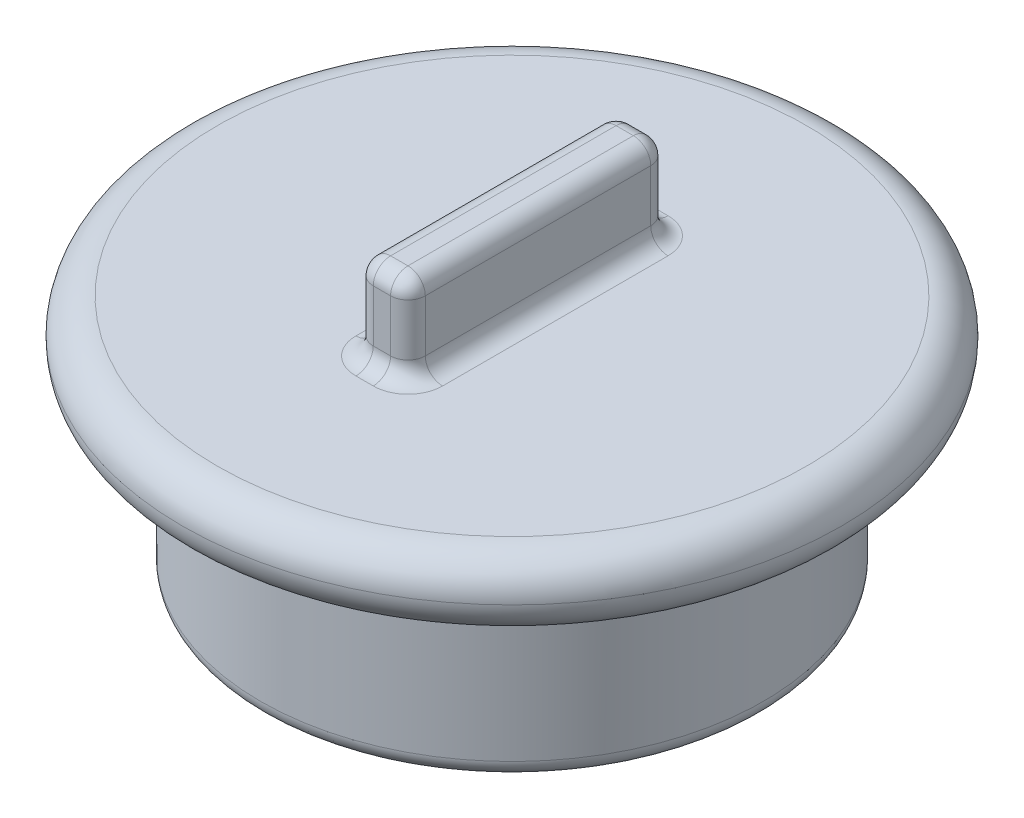
from build123d import *

# Parameters (mm, degrees)
SKETCH_1_R      = 19
EXTRUDE_1_DEPTH = 4
SKETCH_2_W      = 3
SKETCH_2_H      = 15
EXTRUDE_2_DEPTH = 5
FILLET_1_R      = 1
FILLET_3_R      = 2
SKETCH_3_R      = 14.5
SKETCH_3_R_2    = 12.5
EXTRUDE_3_DEPTH = 10
FILLET_4_R      = 1


with BuildPart() as part:
    # 草圖1 → 填料-伸長1 (new body)
    with BuildSketch(Plane(origin=(0, 0, 0), x_dir=(1, 0, 0), z_dir=(0, 1, 0))):
        with Locations(Location((0, 0, 0), (0, 0, 270))):
            Circle(SKETCH_1_R)
    extrude(amount=EXTRUDE_1_DEPTH)

    # 草圖2 → 填料-伸長2 (add)
    with BuildSketch(Plane(origin=(0, 4, 0), x_dir=(1, 0, 0), z_dir=(0, 1, 0))):
        Rectangle(SKETCH_2_W, SKETCH_2_H)
    extrude(amount=EXTRUDE_2_DEPTH)

    # 圓角1
    fillet_1_edges = [part.edges().sort_by_distance(p)[0] for p in [
        (-1.5, 4, 0),
        (-1.5, 6.5, -7.5),
        (0, 4, 7.5),
        (-1.5, 6.5, 7.5),
        (1.5, 4, 0),
        (1.5, 6.5, 7.5),
        (0, 4, -7.5),
        (1.5, 6.5, -7.5),
        (-1.5, 9, 0),
        (0, 9, 7.5),
        (1.5, 9, 0),
        (0, 9, -7.5),
    ]]
    fillet(fillet_1_edges, radius=FILLET_1_R)

    # 圓角3
    fillet_3_edges = [part.edges().sort_by_distance(p)[0] for p in [
        (0, 0, -19),
        (0, 4, -19),
    ]]
    fillet(fillet_3_edges, radius=FILLET_3_R - 0.0001)  # a hair under: the kernel refuses the full size

    # 草圖3 → 填料-伸長3 (add)
    with BuildSketch(Plane.XZ):
        with Locations(Location((0, 0, 0), (0, 0, 90))):
            Circle(SKETCH_3_R)
        with Locations(Location((0, 0, 0), (0, 0, 270))):
            Circle(SKETCH_3_R_2, mode=Mode.SUBTRACT)
    extrude(amount=EXTRUDE_3_DEPTH)

    # 圓角4
    fillet_4_edges = [part.edges().sort_by_distance(p)[0] for p in [
        (0, -10, -14.5),
        (0, -10, 12.5),
    ]]
    fillet(fillet_4_edges, radius=FILLET_4_R - 0.0001)  # a hair under: the kernel refuses the full size


solid = part.part
